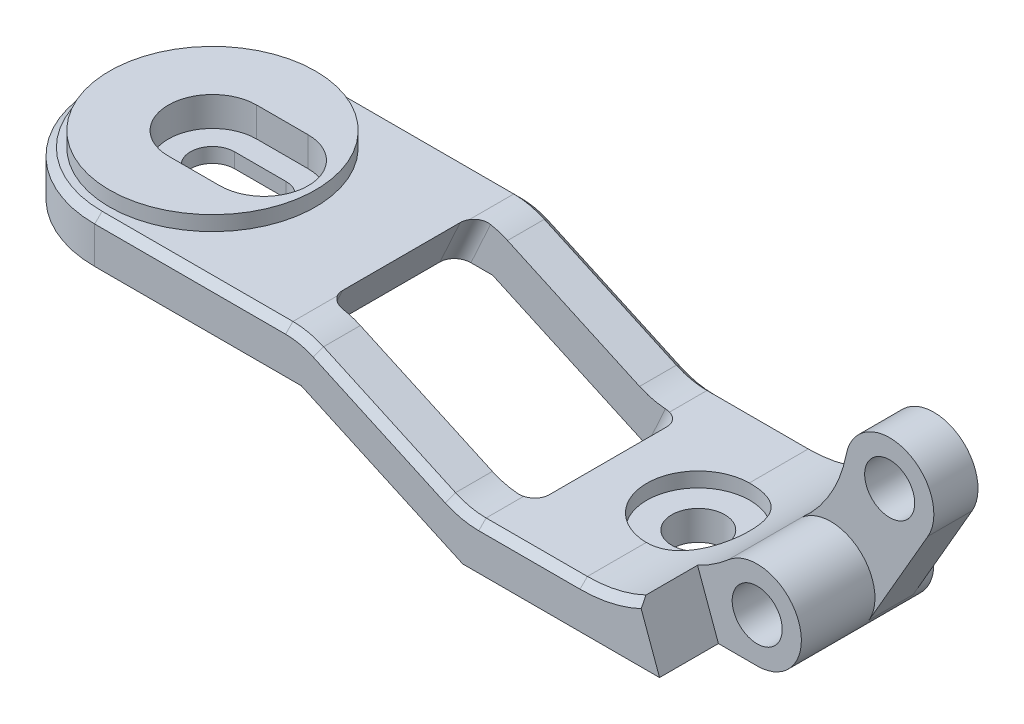
from build123d import *

# Parameters (mm, degrees)
BOSS_EXTRUDE1_DEPTH  = 8
BOSS_EXTRUDE2_START  = -1
BOSS_EXTRUDE2_DEPTH  = 3
CUT_EXTRUDE1_START   = -3
SKETCH2_R            = 3
CUT_EXTRUDE1_DEPTH   = 3
CUT_EXTRUDE2_DEPTH   = 4
SKETCH4_R            = 3.5
CUT_EXTRUDE3_DEPTH   = 8
M3_CLEARANCE_HOLE2_D = 3.4
M3_CLEARANCE_HOLE3_D = 3.4
SKETCH10_R           = 8
BOSS_EXTRUDE3_DEPTH  = 3
BOSS_EXTRUDE6_DEPTH  = 8
SKETCH17_W           = 6
SKETCH17_H           = 6
SKETCH18_R           = 7
BOSS_EXTRUDE5_DEPTH  = 3
CUT_EXTRUDE6_DEPTH   = 2
CUT_EXTRUDE7_DEPTH   = 50.487466177
FILLET5_START        = -8
FILLET5_DEPTH        = 3
SKETCH22_W           = 1.8
SKETCH22_H           = 2.051551118
FILLET12_R           = 5
CHAMFER2_SIZE        = 0.5
SKETCH27_W           = 14.844395474
SKETCH27_H           = 10
CUT_EXTRUDE11_DEPTH  = 13.5
FILLET13_R           = 1


with BuildPart() as part:
    # Sketch1 → Boss-Extrude1 (new, symmetric)
    with BuildSketch(Plane.XY):
        with BuildLine():
            ThreePointArc((42.5, 5.598076211), (40.713681898, 5.986305735), (39.03367226, 5.265735028))
            ThreePointArc((39.03367226, 5.265735028), (36.204522615, 3.584912586), (32.966138903, 3))
            Line((32.966138903, 3), (25, 3))
            Line((25, 3), (25, 0))
            Line((25, 0), (41, 0))
            ThreePointArc((41, 0), (43.897777479, 2.223542865), (42.5, 5.598076211))
        make_face()
    extrude(amount=BOSS_EXTRUDE1_DEPTH, both=True)

    # Sketch1<3> → Boss-Extrude2 (add)
    with BuildSketch(Plane.XY.offset(BOSS_EXTRUDE2_START)):
        with BuildLine():
            ThreePointArc((39.03367226, 5.265735028), (42.909179564, 5.314094508), (43.598076211, 1.5))
            Line((43.598076211, 1.5), (47.598076211, 8.42820323))
            ThreePointArc((47.598076211, 8.42820323), (46.049474916, 12.738648462), (42.054652064, 10.498225632))
            ThreePointArc((42.054652064, 10.498225632), (40.983069487, 7.628577072), (39.03367226, 5.265735028))
        make_face()
    extrude(amount=-BOSS_EXTRUDE2_DEPTH)

    # Sketch2 → Cut-Extrude1 (cut)
    with BuildSketch(Plane(origin=(0, 0, -8), x_dir=(-1, 0, 0), z_dir=(0, 0, -1)).offset(CUT_EXTRUDE1_START)):
        with Locations((-41, 3)):
            Circle(SKETCH2_R)
    extrude(amount=CUT_EXTRUDE1_DEPTH, mode=Mode.SUBTRACT)

    # Sketch3 → Cut-Extrude2 (cut)
    with BuildSketch(Plane.XY.offset(8)):
        with BuildLine():
            ThreePointArc((39.033672152, 5.265734934), (38.036918658, 4.512343291), (36.947790029, 3.900039993))
            Line((36.947790029, 3.900039993), (38.367288499, 0))
            Line((38.367288499, 0), (41, 0))
            ThreePointArc((41, 0), (43.810445232, 4.049474916), (39.033672152, 5.265734934))
        make_face()
    extrude(amount=-CUT_EXTRUDE2_DEPTH, mode=Mode.SUBTRACT)

    # Sketch4 → Cut-Extrude3 (cut)
    with BuildSketch(Plane(origin=(0, 10, 0), x_dir=(-1, 0, 0), z_dir=(0, -1, 0))):
        with Locations(Location((-33, 0, 0), (0, 0, 270.554322343))):
            Circle(SKETCH4_R)
    extrude(amount=CUT_EXTRUDE3_DEPTH, mode=Mode.SUBTRACT)

    # M3 Clearance Hole2 (through all)
    with Locations(Plane(origin=(41, 3, 4), x_dir=(1, 0, 0), z_dir=(0, 0, 1))):
        with Locations((0, 0)):
            Hole(M3_CLEARANCE_HOLE2_D / 2)

    # M3 Clearance Hole3 (through all)
    with Locations(Plane(origin=(45, 9.92820323, -1), x_dir=(1, 0, 0), z_dir=(0, 0, 1))):
        with Locations((0, 0)):
            Hole(M3_CLEARANCE_HOLE3_D / 2)



with BuildPart() as body_2:
    # Sketch10 → Boss-Extrude3 (new body)
    with BuildSketch(Plane(origin=(0, 5, 0), x_dir=(1, 0, 0), z_dir=(0, 1, 0))):
        with Locations(Location((0, 0, 0), (0, 0, 270))):
            Circle(SKETCH10_R)
    extrude(amount=BOSS_EXTRUDE3_DEPTH)


with BuildPart() as part_1:
    add(part.part)

    add(body_2.part)  # Boss-Extrude6 merges body 2
    # Sketch25 → Boss-Extrude6 (add, symmetric)
    with BuildSketch(Plane.XY):
        Polygon((0, 8), (0, 5), (14.033339128, 5), (25, -0.000517039), (25, 3), (14.052552674, 8), align=None)
    extrude(amount=BOSS_EXTRUDE6_DEPTH, both=True)

    # Sketch17 → Cut-Revolve1 (revolve, cut)
    with BuildSketch(Plane.XY, mode=Mode.PRIVATE) as cut_revolve1_sk:
        Polygon((0, 8), (0, 6), (6, 6), (7, 6), (7, 8), align=None)
        with Locations((3, 3)):
            Rectangle(SKETCH17_W, SKETCH17_H)
    revolve(cut_revolve1_sk.sketch.rotate(Axis((0, 6, 0), (0, 1, 0)), 90), axis=Axis((0, 6, 0), (0, 1, 0)), mode=Mode.SUBTRACT)

    # Fillet5: read off the stored shape, not the designer's step
    # Fillet5 outline → Fillet5 (cut)
    with BuildSketch(Plane.XY.offset(FILLET5_START)):
        with BuildLine():
            ThreePointArc((41, 0), (39.866106581, 0.222539701), (38.900437363, 0.857142857))
            ThreePointArc((38.900437363, 0.857142857), (39.013420307, 0.311017763), (38.550510257, 0))
            Line((38.550510257, 0), (41, 0))
        make_face()
        with BuildLine():
            ThreePointArc((37.325347494, 4.090624707), (37.856812417, 4.05249044), (38.052112821, 3.556741573))
            ThreePointArc((38.052112821, 3.556741573), (38.398550037, 4.494141254), (39.033672152, 5.265734934))
            ThreePointArc((39.033672152, 5.265734934), (38.212514543, 4.630198979), (37.325347494, 4.090624707))
        make_face()
    extrude(amount=FILLET5_DEPTH, mode=Mode.SUBTRACT)

    # Sketch22 → M3 Clearance Hole5 (revolve, cut)
    with BuildSketch(Plane(origin=(33, 2, 0), x_dir=(0, 0, 1), z_dir=(1, 0, 0))):
        with Locations((0.9, 1.025775559)):
            Rectangle(SKETCH22_W, SKETCH22_H)
    revolve(axis=Axis((33, 8.35, 0), (0, -1, 0)), mode=Mode.SUBTRACT)

    # Fillet12
    fillet12_edges = [part_1.edges().sort_by_distance(p)[0] for p in [
        (25, 3, 0),
        (14.052552674, 8, 0),
    ]]
    fillet(fillet12_edges, radius=FILLET12_R)

    # Chamfer2
    # the kernel refuses this chamfer: 0.5 mm, written as the material it takes off along each edge
    with BuildSketch(Plane(origin=(41, 3, -8), x_dir=(-0.6998542122558625, -0.7142857142542653, 0), z_dir=(0.7142857142542653, -0.6998542122558625, 0))) as chamfer2_piece_1:
        with BuildLine():
            Line((3.514142136, 0.014142136), (2.985857864, -0.514142136))
            Line((2.985857864, -0.514142136), (2.975857864, -0.514142136))
            ThreePointArc((2.975857864, -0.514142136), (2.99, -0.257071068), (2.99, 0))
            Line((2.99, 0), (3, 0.01))
            ThreePointArc((3, 0.01), (3.257071068, 0.01), (3.514142136, 0.024142136))
            Line((3.514142136, 0.024142136), (3.514142136, 0.014142136))
        make_face()
    revolve(axis=Axis((41, 3, -8), (0, 0, -1)), revolution_arc=56.279671506, mode=Mode.SUBTRACT)
    with BuildSketch(Plane(origin=(37.560798292, 3.649531835, -8), x_dir=(-0.4709015955498913, 0.8821857442220241, 0), z_dir=(-0.8821857442220241, -0.4709015955498913, 0))) as chamfer2_piece_2:
        with BuildLine():
            Line((0.5 - CHAMFER2_SIZE, -CHAMFER2_SIZE * 8.25029964485e-10), (0.514142135, -0.514142136))
            Line((0.514142135, -0.514142136), (0.524142135, -0.514142136))
            ThreePointArc((0.524142135, -0.514142136), (0.51, -0.257071068), (0.51, 0))
            Line((0.51, 0), (0.5, 0.01))
            Line((0.5, 0.01), (0, 0.023753138))
            Line((0, 0.023753138), (0.5 - CHAMFER2_SIZE, -CHAMFER2_SIZE * 8.25029964485e-10))
        make_face()
    revolve(axis=Axis((37.560798292, 3.649531835, -8), (0, 0, -1)), revolution_arc=128.787817104, mode=Mode.SUBTRACT)
    with BuildSketch(Plane(origin=(38.550510258, 0.5, -8), x_dir=(0.6998542113861314, 0.7142857151064245, 0), z_dir=(-0.7142857151064245, 0.6998542113861314, 0))) as chamfer2_piece_3:
        with BuildLine():
            Line((0.5 - CHAMFER2_SIZE, -CHAMFER2_SIZE * 6.45420560746e-10), (0.514142135, -0.514142136))
            Line((0.514142135, -0.514142136), (0.524142135, -0.514142136))
            ThreePointArc((0.524142135, -0.514142136), (0.51, -0.257071068), (0.51, 0))
            Line((0.51, 0), (0.5, 0.01))
            Line((0.5, 0.01), (0, 0.023753138))
            Line((0, 0.023753138), (0.5 - CHAMFER2_SIZE, -CHAMFER2_SIZE * 6.45420560746e-10))
        make_face()
    revolve(axis=Axis((38.550510258, 0.5, -8), (0, 0, -1)), revolution_arc=135.584691531, mode=Mode.SUBTRACT)
    with BuildSketch(Plane(origin=(12.964776572, 8, -8), x_dir=(0, 0, 1), z_dir=(-1, 0, 0)), Plane(origin=(12.964776572, 8, 8), x_dir=(0, -1, 0), z_dir=(-1, 0, 0))) as chamfer2_piece_4:
        with BuildLine():
            Line((0.514142136, 0.014142136), (-0.014142136, -0.514142136))
            Line((-0.014142136, -0.514142136), (-0.024142136, -0.514142136))
            ThreePointArc((-0.024142136, -0.514142136), (-0.01, -0.257071068), (-0.01, 0))
            Line((-0.01, 0), (0, 0.01))
            ThreePointArc((0, 0.01), (0.257071068, 0.01), (0.514142136, 0.024142136))
            Line((0.514142136, 0.024142136), (0.514142136, 0.014142136))
        make_face()
    extrude(amount=12.964776572, mode=Mode.SUBTRACT)
    with BuildSketch(Plane(origin=(24.01054005, 3.451913547, -8), x_dir=(0, 0, 1), z_dir=(-0.9096172905898658, 0.41544721043708044, 0)), Plane(origin=(24.01054005, 3.451913547, 8), x_dir=(-0.4154472104370804, -0.9096172905898657, 0), z_dir=(-0.9096172905898658, 0.41544721043708044, 0))) as chamfer2_piece_5:
        with BuildLine():
            Line((0.514142136, 0.014142136), (-0.014142136, -0.514142136))
            Line((-0.014142136, -0.514142136), (-0.024142136, -0.514142136))
            ThreePointArc((-0.024142136, -0.514142136), (-0.01, -0.257071068), (-0.01, 0))
            Line((-0.01, 0), (0, 0.01))
            ThreePointArc((0, 0.01), (0.257071068, 0.01), (0.514142136, 0.024142136))
            Line((0.514142136, 0.024142136), (0.514142136, 0.014142136))
        make_face()
    extrude(amount=9.859671224, mode=Mode.SUBTRACT)
    with BuildSketch(Plane(origin=(32.966138903, 3, -8), x_dir=(0, 0, 1), z_dir=(-1, 0, 0)), Plane(origin=(32.966138903, 3, 8), x_dir=(0, -1, 0), z_dir=(-1, 0, 0))) as chamfer2_piece_6:
        with BuildLine():
            Line((0.514142136, 0.014142136), (-0.014142136, -0.514142136))
            Line((-0.014142136, -0.514142136), (-0.024142136, -0.514142136))
            ThreePointArc((-0.024142136, -0.514142136), (-0.01, -0.257071068), (-0.01, 0))
            Line((-0.01, 0), (0, 0.01))
            ThreePointArc((0, 0.01), (0.257071068, 0.01), (0.514142136, 0.024142136))
            Line((0.514142136, 0.024142136), (0.514142136, 0.014142136))
        make_face()
    extrude(amount=6.878362801, mode=Mode.SUBTRACT)
    with BuildSketch(Plane(origin=(12.964776572, 3, -8), x_dir=(0.4154472104370811, 0.9096172905898655, 0), z_dir=(0.9096172905898655, -0.4154472104370811, 0))) as chamfer2_piece_7:
        with BuildLine():
            Line((5.014142136, 0.514142136), (4.485857864, -0.014142136))
            Line((4.485857864, -0.014142136), (4.485857864, -0.024142136))
            ThreePointArc((4.485857864, -0.024142136), (4.742928932, -0.01), (5, -0.01))
            Line((5, -0.01), (5.01, 0))
            ThreePointArc((5.01, 0), (5.01, 0.257071068), (5.024142136, 0.514142136))
            Line((5.024142136, 0.514142136), (5.014142136, 0.514142136))
        make_face()
    revolve(axis=Axis((12.964776572, 3, -8), (0, 0, 1)), revolution_arc=24.54748261, mode=Mode.SUBTRACT)
    with BuildSketch(Plane(origin=(12.964776572, 3, 8), x_dir=(0.4154472104370811, 0.9096172905898655, 0), z_dir=(0.9096172905898655, -0.4154472104370811, 0))) as chamfer2_piece_8:
        with BuildLine():
            Line((4.485857864, 0.014142136), (5.014142136, -0.514142136))
            Line((5.014142136, -0.514142136), (5.024142136, -0.514142136))
            ThreePointArc((5.024142136, -0.514142136), (5.01, -0.257071068), (5.01, 0))
            Line((5.01, 0), (5, 0.01))
            ThreePointArc((5, 0.01), (4.742928932, 0.01), (4.485857864, 0.024142136))
            Line((4.485857864, 0.024142136), (4.485857864, 0.014142136))
        make_face()
    revolve(axis=Axis((12.964776572, 3, 8), (0, 0, 1)), revolution_arc=24.54748261, mode=Mode.SUBTRACT)
    with BuildSketch(Plane(origin=(26.087776102, 8, -8), x_dir=(0, -1, 0), z_dir=(1, 0, 0))) as chamfer2_piece_9:
        with BuildLine():
            Line((4.985857864, -0.514142136), (5.514142136, 0.014142136))
            Line((5.514142136, 0.014142136), (5.514142136, 0.024142136))
            ThreePointArc((5.514142136, 0.024142136), (5.257071068, 0.01), (5, 0.01))
            Line((5, 0.01), (4.99, 0))
            ThreePointArc((4.99, 0), (4.99, -0.257071068), (4.975857864, -0.514142136))
            Line((4.975857864, -0.514142136), (4.985857864, -0.514142136))
        make_face()
    revolve(axis=Axis((26.087776102, 8, -8), (0, 0, -1)), revolution_arc=24.54748261, mode=Mode.SUBTRACT)
    with BuildSketch(Plane(origin=(26.087776102, 8, 8), x_dir=(0, -1, 0), z_dir=(1, 0, 0))) as chamfer2_piece_10:
        with BuildLine():
            Line((5.514142136, -0.014142136), (4.985857864, 0.514142136))
            Line((4.985857864, 0.514142136), (4.975857864, 0.514142136))
            ThreePointArc((4.975857864, 0.514142136), (4.99, 0.257071068), (4.99, 0))
            Line((4.99, 0), (5, -0.01))
            ThreePointArc((5, -0.01), (5.257071068, -0.01), (5.514142136, -0.024142136))
            Line((5.514142136, -0.024142136), (5.514142136, -0.014142136))
        make_face()
    revolve(axis=Axis((26.087776102, 8, 8), (0, 0, -1)), revolution_arc=24.54748261, mode=Mode.SUBTRACT)
    with BuildSketch(Plane(origin=(32.966138903, 12.25715402, 8), x_dir=(0.550971832426983, -0.8345238402059301, 0), z_dir=(0.8345238402059301, 0.550971832426983, 0))) as chamfer2_piece_11:
        with BuildLine():
            Line((9.771296156, -0.014142136), (9.243011885, 0.514142136))
            Line((9.243011885, 0.514142136), (9.233011885, 0.514142136))
            ThreePointArc((9.233011885, 0.514142136), (9.24715402, 0.257071068), (9.24715402, 0))
            Line((9.24715402, 0), (9.25715402, -0.01))
            ThreePointArc((9.25715402, -0.01), (9.514225088, -0.01), (9.771296156, -0.024142136))
            Line((9.771296156, -0.024142136), (9.771296156, -0.014142136))
        make_face()
    revolve(axis=Axis((32.966138903, 12.25715402, 8), (0, 0, -1)), revolution_arc=33.433710309, mode=Mode.SUBTRACT)
    with BuildSketch(Plane(origin=(32.966138903, 12.25715402, -8), x_dir=(0.4709015947015472, -0.8821857446748615, 0), z_dir=(0.8821857446748615, 0.4709015947015472, 0))) as chamfer2_piece_12:
        with BuildLine():
            Line((9.243011885, -0.514142136), (9.771296156, 0.014142136))
            Line((9.771296156, 0.014142136), (9.771296156, 0.024142136))
            ThreePointArc((9.771296156, 0.024142136), (9.514225088, 0.01), (9.25715402, 0.01))
            Line((9.25715402, 0.01), (9.24715402, 0))
            ThreePointArc((9.24715402, 0), (9.24715402, -0.257071068), (9.233011885, -0.514142136))
            Line((9.233011885, -0.514142136), (9.243011885, -0.514142136))
        make_face()
    revolve(axis=Axis((32.966138903, 12.25715402, -8), (0, 0, -1)), revolution_arc=28.092836925, mode=Mode.SUBTRACT)
    with BuildSketch(Plane(origin=(23.714158506, 0, -8), x_dir=(0, 0, 1), z_dir=(1, 0, 0))) as chamfer2_piece_13:
        with BuildLine():
            Line((0.514142136, 0.014142136), (-0.014142136, -0.514142136))
            Line((-0.014142136, -0.514142136), (-0.024142136, -0.514142136))
            ThreePointArc((-0.024142136, -0.514142136), (-0.01, -0.257071068), (-0.01, 0))
            Line((-0.01, 0), (0, 0.01))
            ThreePointArc((0, 0.01), (0.257071068, 0.01), (0.514142136, 0.024142136))
            Line((0.514142136, 0.024142136), (0.514142136, 0.014142136))
        make_face()
    extrude(amount=14.836351751, mode=Mode.SUBTRACT)
    with BuildSketch(Plane(origin=(0, 8, 0), x_dir=(0, 0, -1), z_dir=(1, 0, 0))) as chamfer2_piece_14:
        with BuildLine():
            Line((7.485857864, 0.014142136), (8.014142136, -0.514142136))
            Line((8.014142136, -0.514142136), (8.024142136, -0.514142136))
            ThreePointArc((8.024142136, -0.514142136), (8.01, -0.257071068), (8.01, 0))
            Line((8.01, 0), (8, 0.01))
            ThreePointArc((8, 0.01), (7.742928932, 0.01), (7.485857864, 0.024142136))
            Line((7.485857864, 0.024142136), (7.485857864, 0.014142136))
        make_face()
    revolve(axis=Axis((0, 8, 0), (0, 1, 0)), revolution_arc=180, mode=Mode.SUBTRACT)

    # Sketch27 → Cut-Extrude11 (cut, symmetric)
    with BuildSketch(Plane(origin=(5.448603514, 11.929659995, 0), x_dir=(0.9096172905898658, -0.4154472104370803, 0), z_dir=(0.41544721043708027, 0.9096172905898657, 0))):
        with Locations((15.766417415, 0)):
            Rectangle(SKETCH27_W, SKETCH27_H)
    extrude(amount=CUT_EXTRUDE11_DEPTH, both=True, mode=Mode.SUBTRACT)

    # Fillet13
    fillet13_edges = [part_1.edges().sort_by_distance(p)[0] for p in [
        (26.1778071, 1.5, 5),
        (26.1778071, 1.5, -5),
        (12.14205871, 6.5, 5),
        (12.14205871, 6.5, -5),
    ]]
    fillet(fillet13_edges, radius=FILLET13_R)


with BuildPart() as body_2_2:
    # Sketch18 → Boss-Extrude5 (new body)
    with BuildSketch(Plane(origin=(0, 6, 0), x_dir=(1, 0, 0), z_dir=(0, 1, 0))):
        with Locations(Location((0, 0, 0), (0, 0, 270))):
            Circle(SKETCH18_R)
    extrude(amount=BOSS_EXTRUDE5_DEPTH)

    # Sketch19 → Cut-Extrude6 (cut)
    # profile 1 of 2: a face of its own
    with BuildSketch(Plane(origin=(0, 9, 0), x_dir=(1, 0, 0), z_dir=(0, 1, 0))):
        with BuildLine():
            Line((0, -3), (3.5, -3))
            ThreePointArc((3.5, -3), (6.5, 0), (3.5, 3))
            Line((3.5, 3), (0, 3))
            ThreePointArc((0, 3), (-3, 0), (0, -3))
        make_face()
        with BuildLine():
            ThreePointArc((3.5, -1.5), (5, 0), (3.5, 1.5))
            Line((3.5, 1.5), (0, 1.5))
            ThreePointArc((0, 1.5), (-1.5, 0), (0, -1.5))
            Line((0, -1.5), (3.5, -1.5))
        make_face(mode=Mode.SUBTRACT)
    # profile 2 of 2: a face of its own
    with BuildSketch(Plane(origin=(0, 9, 0), x_dir=(1, 0, 0), z_dir=(0, 1, 0))):
        with BuildLine():
            Line((0, -1.5), (3.5, -1.5))
            ThreePointArc((3.5, -1.5), (5, 0), (3.5, 1.5))
            Line((3.5, 1.5), (0, 1.5))
            ThreePointArc((0, 1.5), (-1.5, 0), (0, -1.5))
        make_face()
    extrude(amount=-CUT_EXTRUDE6_DEPTH, mode=Mode.SUBTRACT)

    # Sketch19<3> → Cut-Extrude7 (cut, through all)
    with BuildSketch(Plane(origin=(0, 9, 0), x_dir=(1, 0, 0), z_dir=(0, 1, 0))):
        with BuildLine():
            Line((0, 1.5), (3.5, 1.5))
            ThreePointArc((3.5, 1.5), (5, 0), (3.5, -1.5))
            Line((3.5, -1.5), (0, -1.5))
            ThreePointArc((0, -1.5), (-1.5, 0), (0, 1.5))
        make_face()
    extrude(amount=-CUT_EXTRUDE7_DEPTH, mode=Mode.SUBTRACT)


solid = Compound([part_1.part, body_2_2.part])
